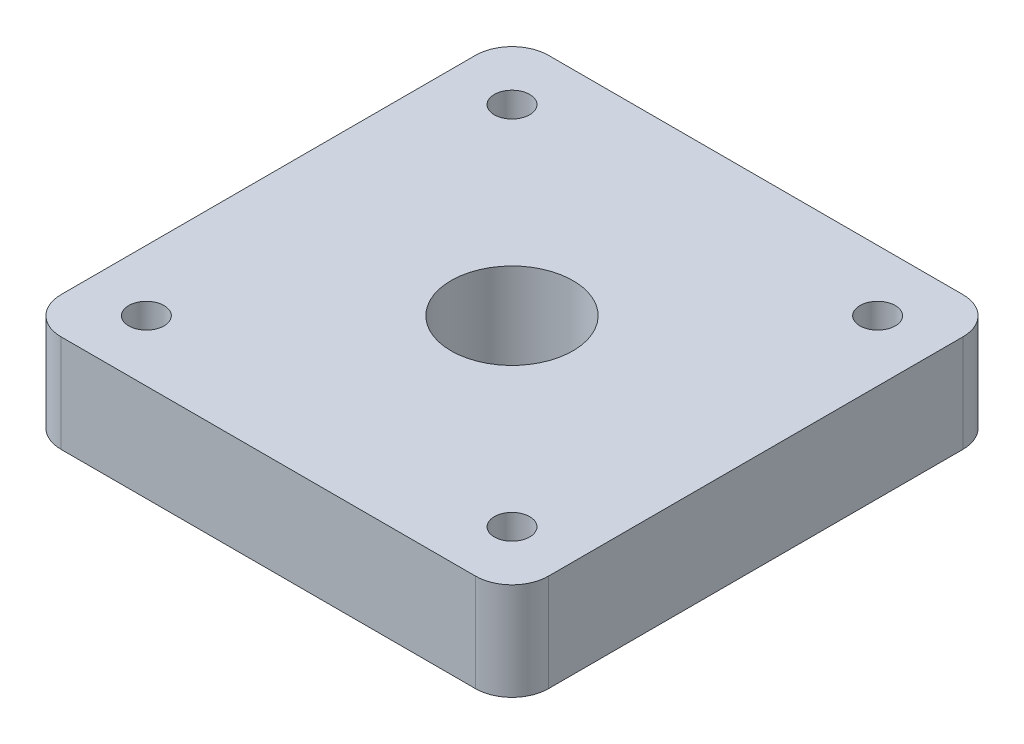
from build123d import *

# Parameters (mm, degrees)
SKETCH1_W           = 40
SKETCH1_H           = 40
SKETCH1_R           = 5
BOSS_EXTRUDE1_DEPTH = 8
SKETCH12_R          = 1.45
CUT_EXTRUDE1_DEPTH  = 58.053472861
FILLET1_R           = 3


with BuildPart() as part:
    # Sketch1 → Boss-Extrude1 (new body)
    with BuildSketch(Plane(origin=(0, 0, 0), x_dir=(1, 0, 0), z_dir=(0, 1, 0))):
        with Locations((20, -19.888579387)):
            Rectangle(SKETCH1_W, SKETCH1_H)
        with Locations((20, -19.888579387)):
            Circle(SKETCH1_R, mode=Mode.SUBTRACT)
    extrude(amount=BOSS_EXTRUDE1_DEPTH)

    # Sketch12 → Cut-Extrude1 (cut, through all)
    with BuildSketch(Plane(origin=(0, 8, 0), x_dir=(1, 0, 0), z_dir=(0, 1, 0))):
        with Locations((5, -4.888579387)):
            Circle(SKETCH12_R)
        with Locations((35, -4.888579387)):
            Circle(SKETCH12_R)
        with Locations((35, -34.888579387)):
            Circle(SKETCH12_R)
        with Locations((5, -34.888579387)):
            Circle(SKETCH12_R)
    extrude(amount=-CUT_EXTRUDE1_DEPTH, mode=Mode.SUBTRACT)

    # Fillet1
    fillet1_edges = [part.edges().sort_by_distance(p)[0] for p in [
        (40, 4, 39.888579387),
        (40, 4, -0.111420613),
        (0, 4, -0.111420613),
        (0, 4, 39.888579387),
    ]]
    fillet(fillet1_edges, radius=FILLET1_R)


solid = part.part
